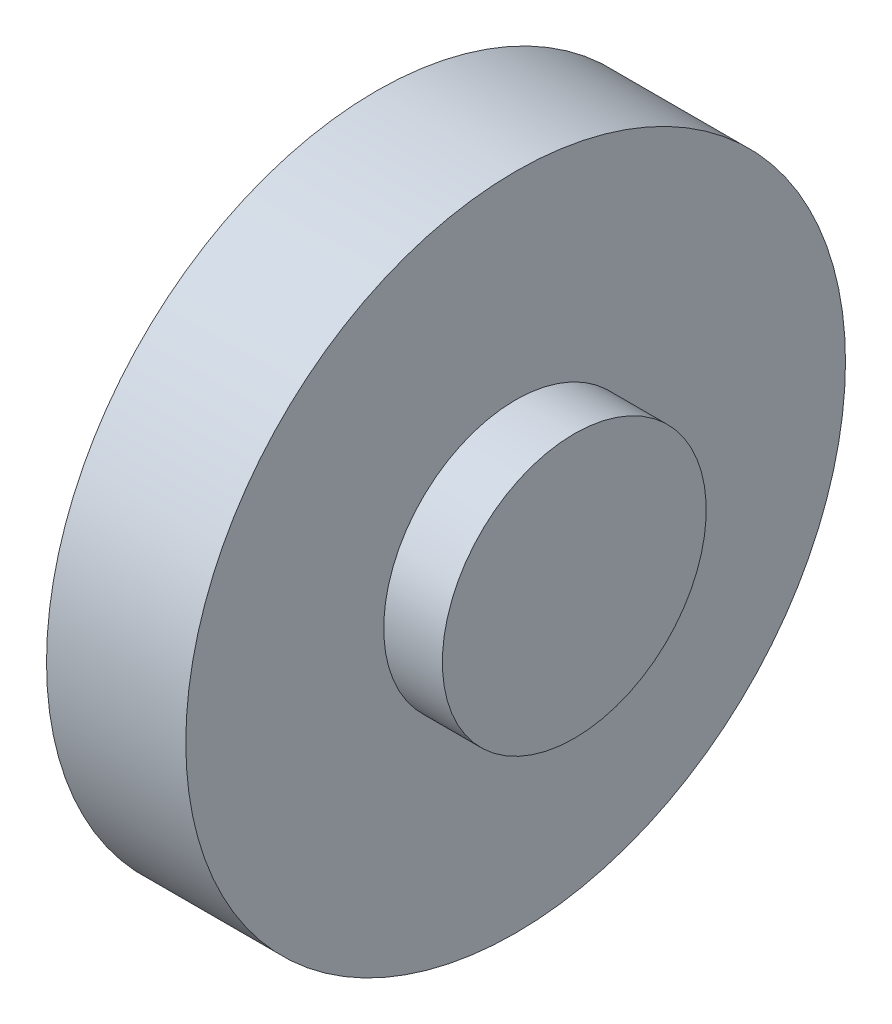
from build123d import *


with BuildPart() as part:
    # Sketch2 → Revolve1 (revolve)
    with BuildSketch(Plane.XY):
        Polygon((0, 0), (0, 10), (10, 10), (10, 45), (29, 45), (29, 18), (37, 18), (37, 0), align=None)
    revolve(axis=Axis((-78.877853563, 0, 0), (1, 0, 0)))


solid = part.part
